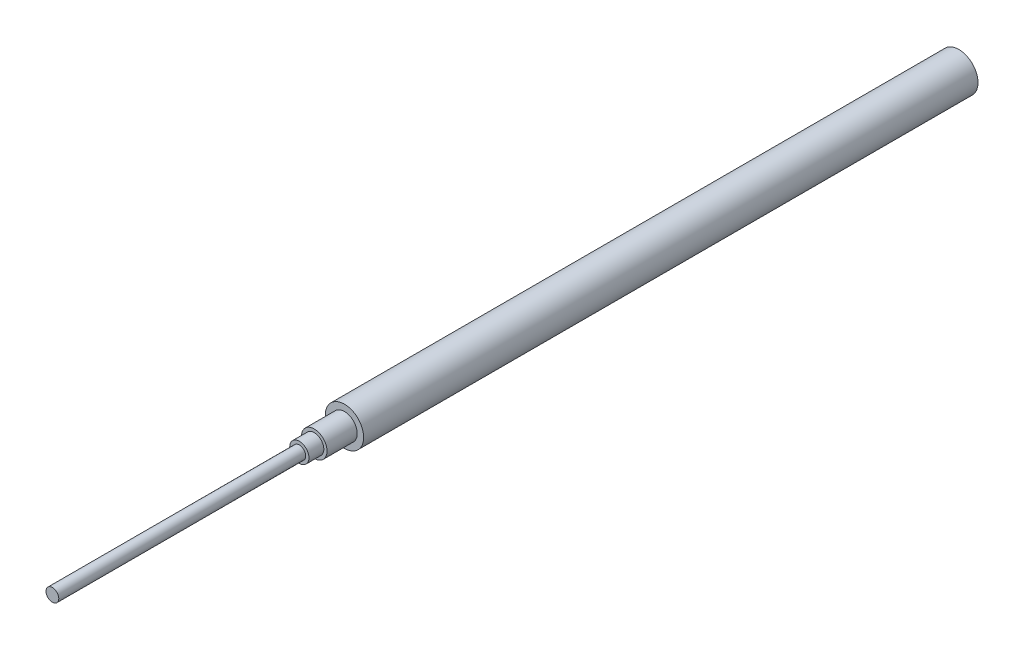
from build123d import *

# Parameters (mm, degrees)
SKETCH1_R           = 4.7625
BOSS_EXTRUDE1_DEPTH = 152.5
SKETCH2_R           = 3.175
BOSS_EXTRUDE2_DEPTH = 160
SKETCH3_R           = 2.38125
BOSS_EXTRUDE3_DEPTH = 163.7
SKETCH4_R           = 1.5875
BOSS_EXTRUDE4_DEPTH = 225


with BuildPart() as part:
    # Sketch1 → Boss-Extrude1 (new body)
    with BuildSketch(Plane.XY):
        Circle(SKETCH1_R)
    extrude(amount=BOSS_EXTRUDE1_DEPTH)

    # Sketch2 → Boss-Extrude2 (add)
    with BuildSketch(Plane.XY):
        Circle(SKETCH2_R)
    extrude(amount=BOSS_EXTRUDE2_DEPTH)

    # Sketch3 → Boss-Extrude3 (add)
    with BuildSketch(Plane.XY):
        Circle(SKETCH3_R)
    extrude(amount=BOSS_EXTRUDE3_DEPTH)

    # Sketch4 → Boss-Extrude4 (add)
    with BuildSketch(Plane.XY):
        Circle(SKETCH4_R)
    extrude(amount=BOSS_EXTRUDE4_DEPTH)


solid = part.part
